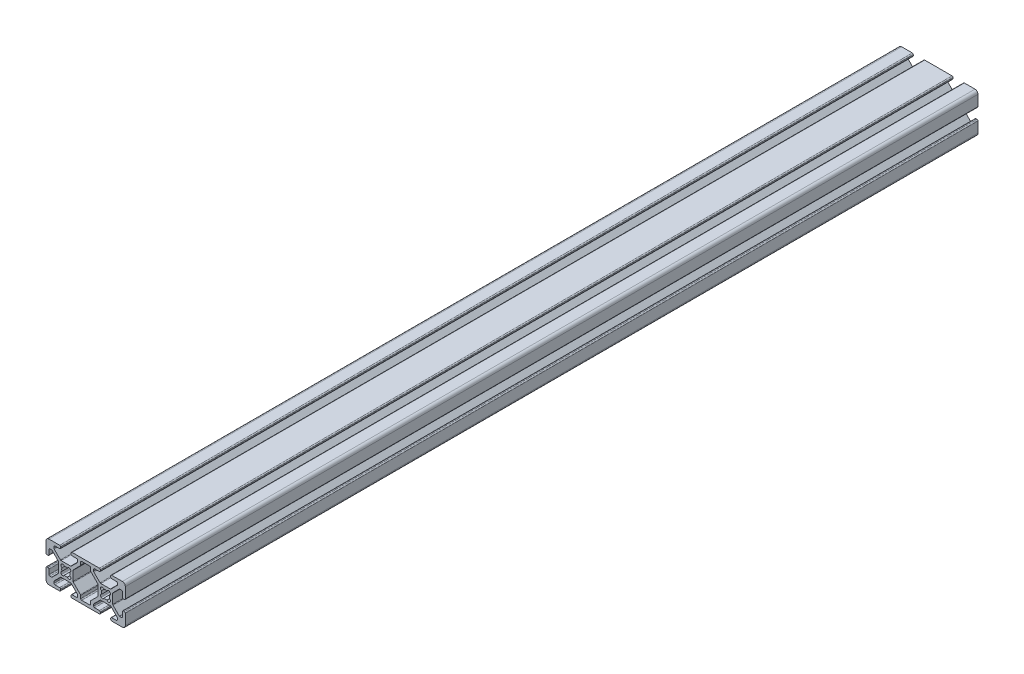
from build123d import *

# Parameters (mm, degrees)
EXTRUDE1_DEPTH = 430


with BuildPart() as part:
    # Sketch1 → Extrude1 (new body)
    with BuildSketch(Plane.XY):
        with BuildLine():
            Line((-22.383919339, -3.655), (-17.616080661, -3.655))
            ThreePointArc((-17.616080661, -3.655), (-17.421677478, -3.693669197), (-17.256870417, -3.803789755))
            Line((-17.256870417, -3.803789755), (-14.153789755, -6.906870417))
            ThreePointArc((-14.153789755, -6.906870417), (-14.043669197, -7.071677478), (-14.005, -7.266080661))
            Line((-14.005, -7.266080661), (-14.005, -7.992))
            ThreePointArc((-14.005, -7.992), (-14.153789755, -8.351210245), (-14.513, -8.5))
            Line((-14.513, -8.5), (-16.862, -8.5))
            ThreePointArc((-16.862, -8.5), (-17.221210245, -8.648789755), (-17.37, -9.008))
            Line((-17.37, -9.008), (-17.37, -9.492))
            ThreePointArc((-17.37, -9.492), (-17.221210245, -9.851210245), (-16.862, -10))
            Line((-16.862, -10), (-3.138, -10))
            ThreePointArc((-3.138, -10), (-2.778789755, -9.851210245), (-2.63, -9.492))
            Line((-2.63, -9.492), (-2.63, -9.008))
            ThreePointArc((-2.63, -9.008), (-2.778789755, -8.648789755), (-3.138, -8.5))
            Line((-3.138, -8.5), (-5.487, -8.5))
            ThreePointArc((-5.487, -8.5), (-5.846210245, -8.351210245), (-5.995, -7.992))
            Line((-5.995, -7.992), (-5.995, -7.266080661))
            ThreePointArc((-5.995, -7.266080661), (-5.956330803, -7.071677478), (-5.846210245, -6.906870417))
            Line((-5.846210245, -6.906870417), (-2.743129583, -3.803789755))
            ThreePointArc((-2.743129583, -3.803789755), (-2.578322522, -3.693669197), (-2.383919339, -3.655))
            Line((-2.383919339, -3.655), (2.383919339, -3.655))
            ThreePointArc((2.383919339, -3.655), (2.578322522, -3.693669197), (2.743129583, -3.803789755))
            Line((2.743129583, -3.803789755), (5.846210245, -6.906870417))
            ThreePointArc((5.846210245, -6.906870417), (5.956330803, -7.071677478), (5.995, -7.266080661))
            Line((5.995, -7.266080661), (5.995, -7.992))
            ThreePointArc((5.995, -7.992), (5.846210245, -8.351210245), (5.487, -8.5))
            Line((5.487, -8.5), (3.138, -8.5))
            ThreePointArc((3.138, -8.5), (2.778789755, -8.648789755), (2.63, -9.008))
            Line((2.63, -9.008), (2.63, -9.492))
            ThreePointArc((2.63, -9.492), (2.778789755, -9.851210245), (3.138, -10))
            Line((3.138, -10), (8.5, -10))
            ThreePointArc((8.5, -10), (9.560660172, -9.560660172), (10, -8.5))
            Line((10, -8.5), (10, -3.138))
            ThreePointArc((10, -3.138), (9.851210245, -2.778789755), (9.492, -2.63))
            Line((9.492, -2.63), (9.008, -2.63))
            ThreePointArc((9.008, -2.63), (8.648789755, -2.778789755), (8.5, -3.138))
            Line((8.5, -3.138), (8.5, -5.487))
            ThreePointArc((8.5, -5.487), (8.351210245, -5.846210245), (7.992, -5.995))
            Line((7.992, -5.995), (7.266080661, -5.995))
            ThreePointArc((7.266080661, -5.995), (7.071677478, -5.956330803), (6.906870417, -5.846210245))
            Line((6.906870417, -5.846210245), (3.803789755, -2.743129583))
            ThreePointArc((3.803789755, -2.743129583), (3.693669197, -2.578322522), (3.655, -2.383919339))
            Line((3.655, -2.383919339), (3.655, 2.383919339))
            ThreePointArc((3.655, 2.383919339), (3.693669197, 2.578322522), (3.803789755, 2.743129583))
            Line((3.803789755, 2.743129583), (6.906870417, 5.846210245))
            ThreePointArc((6.906870417, 5.846210245), (7.071677478, 5.956330803), (7.266080661, 5.995))
            Line((7.266080661, 5.995), (7.992, 5.995))
            ThreePointArc((7.992, 5.995), (8.351210245, 5.846210245), (8.5, 5.487))
            Line((8.5, 5.487), (8.5, 3.138))
            ThreePointArc((8.5, 3.138), (8.648789755, 2.778789755), (9.008, 2.63))
            Line((9.008, 2.63), (9.492, 2.63))
            ThreePointArc((9.492, 2.63), (9.851210245, 2.778789755), (10, 3.138))
            Line((10, 3.138), (10, 8.5))
            ThreePointArc((10, 8.5), (9.560660172, 9.560660172), (8.5, 10))
            Line((8.5, 10), (3.138, 10))
            ThreePointArc((3.138, 10), (2.778789755, 9.851210245), (2.63, 9.492))
            Line((2.63, 9.492), (2.63, 9.008))
            ThreePointArc((2.63, 9.008), (2.778789755, 8.648789755), (3.138, 8.5))
            Line((3.138, 8.5), (5.487, 8.5))
            ThreePointArc((5.487, 8.5), (5.846210245, 8.351210245), (5.995, 7.992))
            Line((5.995, 7.992), (5.995, 7.266080661))
            ThreePointArc((5.995, 7.266080661), (5.956330803, 7.071677478), (5.846210245, 6.906870417))
            Line((5.846210245, 6.906870417), (2.743129583, 3.803789755))
            ThreePointArc((2.743129583, 3.803789755), (2.578322522, 3.693669197), (2.383919339, 3.655))
            Line((2.383919339, 3.655), (-2.383919339, 3.655))
            ThreePointArc((-2.383919339, 3.655), (-2.578322522, 3.693669197), (-2.743129583, 3.803789755))
            Line((-2.743129583, 3.803789755), (-5.846210245, 6.906870417))
            ThreePointArc((-5.846210245, 6.906870417), (-5.956330803, 7.071677478), (-5.995, 7.266080661))
            Line((-5.995, 7.266080661), (-5.995, 7.992))
            ThreePointArc((-5.995, 7.992), (-5.846210245, 8.351210245), (-5.487, 8.5))
            Line((-5.487, 8.5), (-3.138, 8.5))
            ThreePointArc((-3.138, 8.5), (-2.778789755, 8.648789755), (-2.63, 9.008))
            Line((-2.63, 9.008), (-2.63, 9.492))
            ThreePointArc((-2.63, 9.492), (-2.778789755, 9.851210245), (-3.138, 10))
            Line((-3.138, 10), (-16.862, 10))
            ThreePointArc((-16.862, 10), (-17.221210245, 9.851210245), (-17.37, 9.492))
            Line((-17.37, 9.492), (-17.37, 9.008))
            ThreePointArc((-17.37, 9.008), (-17.221210245, 8.648789755), (-16.862, 8.5))
            Line((-16.862, 8.5), (-14.513, 8.5))
            ThreePointArc((-14.513, 8.5), (-14.153789755, 8.351210245), (-14.005, 7.992))
            Line((-14.005, 7.992), (-14.005, 7.266080661))
            ThreePointArc((-14.005, 7.266080661), (-14.043669197, 7.071677478), (-14.153789755, 6.906870417))
            Line((-14.153789755, 6.906870417), (-17.256870417, 3.803789755))
            ThreePointArc((-17.256870417, 3.803789755), (-17.421677478, 3.693669197), (-17.616080661, 3.655))
            Line((-17.616080661, 3.655), (-22.383919339, 3.655))
            ThreePointArc((-22.383919339, 3.655), (-22.578322522, 3.693669197), (-22.743129583, 3.803789755))
            Line((-22.743129583, 3.803789755), (-25.846210245, 6.906870417))
            ThreePointArc((-25.846210245, 6.906870417), (-25.956330803, 7.071677478), (-25.995, 7.266080661))
            Line((-25.995, 7.266080661), (-25.995, 7.992))
            ThreePointArc((-25.995, 7.992), (-25.846210245, 8.351210245), (-25.487, 8.5))
            Line((-25.487, 8.5), (-23.138, 8.5))
            ThreePointArc((-23.138, 8.5), (-22.778789755, 8.648789755), (-22.63, 9.008))
            Line((-22.63, 9.008), (-22.63, 9.492))
            ThreePointArc((-22.63, 9.492), (-22.778789755, 9.851210245), (-23.138, 10))
            Line((-23.138, 10), (-28.5, 10))
            ThreePointArc((-28.5, 10), (-29.560660172, 9.560660172), (-30, 8.5))
            Line((-30, 8.5), (-30, 3.138))
            ThreePointArc((-30, 3.138), (-29.851210245, 2.778789755), (-29.492, 2.63))
            Line((-29.492, 2.63), (-29.008, 2.63))
            ThreePointArc((-29.008, 2.63), (-28.648789755, 2.778789755), (-28.5, 3.138))
            Line((-28.5, 3.138), (-28.5, 5.487))
            ThreePointArc((-28.5, 5.487), (-28.351210245, 5.846210245), (-27.992, 5.995))
            Line((-27.992, 5.995), (-27.266080661, 5.995))
            ThreePointArc((-27.266080661, 5.995), (-27.071677478, 5.956330803), (-26.906870417, 5.846210245))
            Line((-26.906870417, 5.846210245), (-23.803789755, 2.743129583))
            ThreePointArc((-23.803789755, 2.743129583), (-23.693669197, 2.578322522), (-23.655, 2.383919339))
            Line((-23.655, 2.383919339), (-23.655, -2.383919339))
            ThreePointArc((-23.655, -2.383919339), (-23.693669197, -2.578322522), (-23.803789755, -2.743129583))
            Line((-23.803789755, -2.743129583), (-26.906870417, -5.846210245))
            ThreePointArc((-26.906870417, -5.846210245), (-27.071677478, -5.956330803), (-27.266080661, -5.995))
            Line((-27.266080661, -5.995), (-27.992, -5.995))
            ThreePointArc((-27.992, -5.995), (-28.351210245, -5.846210245), (-28.5, -5.487))
            Line((-28.5, -5.487), (-28.5, -3.138))
            ThreePointArc((-28.5, -3.138), (-28.648789755, -2.778789755), (-29.008, -2.63))
            Line((-29.008, -2.63), (-29.492, -2.63))
            ThreePointArc((-29.492, -2.63), (-29.851210245, -2.778789755), (-30, -3.138))
            Line((-30, -3.138), (-30, -8.5))
            ThreePointArc((-30, -8.5), (-29.560660172, -9.560660172), (-28.5, -10))
            Line((-28.5, -10), (-23.138, -10))
            ThreePointArc((-23.138, -10), (-22.778789755, -9.851210245), (-22.63, -9.492))
            Line((-22.63, -9.492), (-22.63, -9.008))
            ThreePointArc((-22.63, -9.008), (-22.778789755, -8.648789755), (-23.138, -8.5))
            Line((-23.138, -8.5), (-25.487, -8.5))
            ThreePointArc((-25.487, -8.5), (-25.846210245, -8.351210245), (-25.995, -7.992))
            Line((-25.995, -7.992), (-25.995, -7.266080661))
            ThreePointArc((-25.995, -7.266080661), (-25.956330803, -7.071677478), (-25.846210245, -6.906870417))
            Line((-25.846210245, -6.906870417), (-22.743129583, -3.803789755))
            ThreePointArc((-22.743129583, -3.803789755), (-22.578322522, -3.693669197), (-22.383919339, -3.655))
        make_face()
        with BuildLine():
            Line((-2.124900844, -2.304505966), (-2.304505966, -2.124900844))
            ThreePointArc((-2.304505966, -2.124900844), (-2.505938017, -1.356467811), (-1.935133506, -0.803976718))
            ThreePointArc((-1.935133506, -0.803976718), (-2.0955, 0), (-1.935133506, 0.803976718))
            ThreePointArc((-1.935133506, 0.803976718), (-2.505938017, 1.356467811), (-2.304505966, 2.124900844))
            Line((-2.304505966, 2.124900844), (-2.124900844, 2.304505966))
            ThreePointArc((-2.124900844, 2.304505966), (-1.356467811, 2.505938017), (-0.803976718, 1.935133506))
            ThreePointArc((-0.803976718, 1.935133506), (0, 2.0955), (0.803976718, 1.935133506))
            ThreePointArc((0.803976718, 1.935133506), (1.356467811, 2.505938017), (2.124900844, 2.304505966))
            Line((2.124900844, 2.304505966), (2.304505966, 2.124900844))
            ThreePointArc((2.304505966, 2.124900844), (2.505938017, 1.356467811), (1.935133506, 0.803976718))
            ThreePointArc((1.935133506, 0.803976718), (2.0955, 0), (1.935133506, -0.803976718))
            ThreePointArc((1.935133506, -0.803976718), (2.505938017, -1.356467811), (2.304505966, -2.124900844))
            Line((2.304505966, -2.124900844), (2.124900844, -2.304505966))
            ThreePointArc((2.124900844, -2.304505966), (1.356467811, -2.505938017), (0.803976718, -1.935133506))
            ThreePointArc((0.803976718, -1.935133506), (0, -2.0955), (-0.803976718, -1.935133506))
            ThreePointArc((-0.803976718, -1.935133506), (-1.356467811, -2.505938017), (-2.124900844, -2.304505966))
        make_face(mode=Mode.SUBTRACT)
        with BuildLine():
            Line((-12.505, -7.992), (-12.505, -6.644760318))
            ThreePointArc((-12.505, -6.644760318), (-12.543669197, -6.450357134), (-12.653789755, -6.285550073))
            Line((-12.653789755, -6.285550073), (-16.196210245, -2.743129583))
            ThreePointArc((-16.196210245, -2.743129583), (-16.306330803, -2.578322522), (-16.345, -2.383919339))
            Line((-16.345, -2.383919339), (-16.345, 2.383919339))
            ThreePointArc((-16.345, 2.383919339), (-16.306330803, 2.578322522), (-16.196210245, 2.743129583))
            Line((-16.196210245, 2.743129583), (-12.653789755, 6.285550073))
            ThreePointArc((-12.653789755, 6.285550073), (-12.543669197, 6.450357134), (-12.505, 6.644760318))
            Line((-12.505, 6.644760318), (-12.505, 7.992))
            ThreePointArc((-12.505, 7.992), (-12.356210245, 8.351210245), (-11.997, 8.5))
            Line((-11.997, 8.5), (-8.003, 8.5))
            ThreePointArc((-8.003, 8.5), (-7.643789755, 8.351210245), (-7.495, 7.992))
            Line((-7.495, 7.992), (-7.495, 6.644760318))
            ThreePointArc((-7.495, 6.644760318), (-7.456330803, 6.450357134), (-7.346210245, 6.285550073))
            Line((-7.346210245, 6.285550073), (-3.803789755, 2.743129583))
            ThreePointArc((-3.803789755, 2.743129583), (-3.693669197, 2.578322522), (-3.655, 2.383919339))
            Line((-3.655, 2.383919339), (-3.655, -2.383919339))
            ThreePointArc((-3.655, -2.383919339), (-3.693669197, -2.578322522), (-3.803789755, -2.743129583))
            Line((-3.803789755, -2.743129583), (-7.346210245, -6.285550073))
            ThreePointArc((-7.346210245, -6.285550073), (-7.456330803, -6.450357134), (-7.495, -6.644760318))
            Line((-7.495, -6.644760318), (-7.495, -7.992))
            ThreePointArc((-7.495, -7.992), (-7.643789755, -8.351210245), (-8.003, -8.5))
            Line((-8.003, -8.5), (-11.997, -8.5))
            ThreePointArc((-11.997, -8.5), (-12.356210245, -8.351210245), (-12.505, -7.992))
        make_face(mode=Mode.SUBTRACT)
        with BuildLine():
            Line((-22.124900844, -2.304505966), (-22.304505966, -2.124900844))
            ThreePointArc((-22.304505966, -2.124900844), (-22.505938017, -1.356467811), (-21.935133506, -0.803976718))
            ThreePointArc((-21.935133506, -0.803976718), (-22.0955, 0), (-21.935133506, 0.803976718))
            ThreePointArc((-21.935133506, 0.803976718), (-22.505938017, 1.356467811), (-22.304505966, 2.124900844))
            Line((-22.304505966, 2.124900844), (-22.124900844, 2.304505966))
            ThreePointArc((-22.124900844, 2.304505966), (-21.356467811, 2.505938017), (-20.803976718, 1.935133506))
            ThreePointArc((-20.803976718, 1.935133506), (-20, 2.0955), (-19.196023282, 1.935133506))
            ThreePointArc((-19.196023282, 1.935133506), (-18.643532189, 2.505938017), (-17.875099156, 2.304505966))
            Line((-17.875099156, 2.304505966), (-17.695494034, 2.124900844))
            ThreePointArc((-17.695494034, 2.124900844), (-17.494061983, 1.356467811), (-18.064866494, 0.803976718))
            ThreePointArc((-18.064866494, 0.803976718), (-17.9045, 0), (-18.064866494, -0.803976718))
            ThreePointArc((-18.064866494, -0.803976718), (-17.494061983, -1.356467811), (-17.695494034, -2.124900844))
            Line((-17.695494034, -2.124900844), (-17.875099156, -2.304505966))
            ThreePointArc((-17.875099156, -2.304505966), (-18.643532189, -2.505938017), (-19.196023282, -1.935133506))
            ThreePointArc((-19.196023282, -1.935133506), (-20, -2.0955), (-20.803976718, -1.935133506))
            ThreePointArc((-20.803976718, -1.935133506), (-21.356467811, -2.505938017), (-22.124900844, -2.304505966))
        make_face(mode=Mode.SUBTRACT)
    extrude(amount=-EXTRUDE1_DEPTH)


solid = part.part
